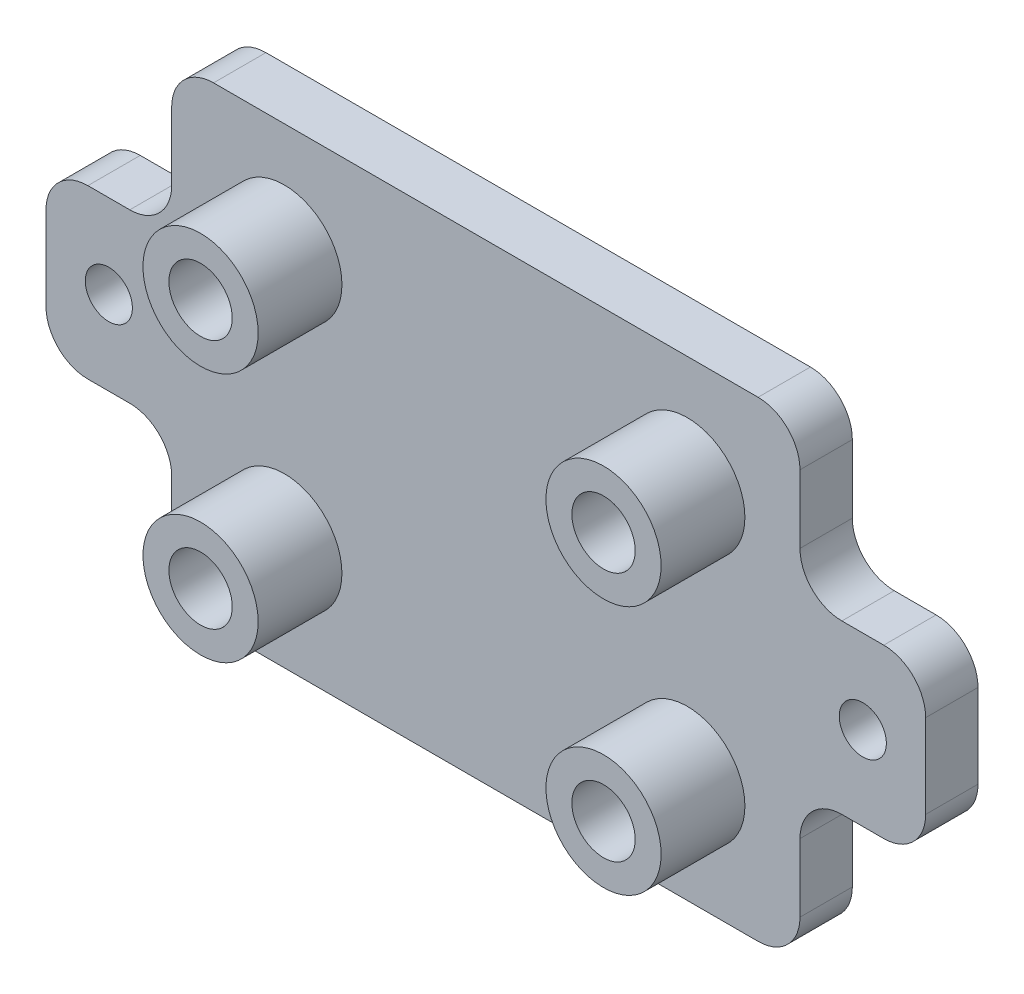
from build123d import *

# Parameters (mm, degrees)
SKETCH1_W            = 60
SKETCH1_H            = 45
BOSS_EXTRUDE1_DEPTH  = 5
SKETCH3_R            = 5.5
SKETCH3_R_2          = 3.025
BOSS_EXTRUDE2_DEPTH  = 8
SKETCH4_W            = 12
SKETCH4_H            = 16
SKETCH4_R            = 2.55
BOSS_EXTRUDE3_DEPTH  = 5
FILLET1_R            = 4
M4_CLEARANCE_HOLE1_D = 4.5
MIRROR1_OUTLINE_R    = 2.25
MIRROR1_DEPTH        = 5
FILLET2_R            = 4


# Read off the part's stored shape, not the designer's step: Mirror1
with BuildPart() as part:
    # Sketch1 → Boss-Extrude1 (new body)
    with BuildSketch(Plane.XY):
        Rectangle(SKETCH1_W, SKETCH1_H)
    extrude(amount=BOSS_EXTRUDE1_DEPTH)

    # Sketch3 → Boss-Extrude2 (add)
    # profile 1 of 4: a face of its own
    with BuildSketch(Plane.XY.offset(5)):
        with Locations((-19.2405, 11.938)):
            Circle(SKETCH3_R)
        with Locations((-19.2405, 11.938)):
            Circle(SKETCH3_R_2, mode=Mode.SUBTRACT)
    # profile 2 of 4: a face of its own
    with BuildSketch(Plane.XY.offset(5)):
        with Locations((-19.2405, -11.938)):
            Circle(SKETCH3_R)
        with Locations((-19.2405, -11.938)):
            Circle(SKETCH3_R_2, mode=Mode.SUBTRACT)
    # profile 3 of 4: a face of its own
    with BuildSketch(Plane.XY.offset(5)):
        with Locations((19.2405, 11.938)):
            Circle(SKETCH3_R)
        with Locations((19.2405, 11.938)):
            Circle(SKETCH3_R_2, mode=Mode.SUBTRACT)
    # profile 4 of 4: a face of its own
    with BuildSketch(Plane.XY.offset(5)):
        with Locations((19.2405, -11.938)):
            Circle(SKETCH3_R)
        with Locations((19.2405, -11.938)):
            Circle(SKETCH3_R_2, mode=Mode.SUBTRACT)
    extrude(amount=BOSS_EXTRUDE2_DEPTH)

    # Sketch4 → Boss-Extrude3 (add)
    # profile 1 of 2: a face of its own
    with BuildSketch(Plane.XY.offset(5)):
        with Locations((-36, 0)):
            Rectangle(SKETCH4_W, SKETCH4_H)
        with Locations((-36, 0)):
            Circle(SKETCH4_R, mode=Mode.SUBTRACT)
    # profile 2 of 2: a face of its own
    with BuildSketch(Plane.XY.offset(5)):
        with Locations((-36, 0)):
            Circle(SKETCH4_R)
    extrude(amount=-BOSS_EXTRUDE3_DEPTH)

    # Fillet1
    fillet1_edges = [part.edges().sort_by_distance(p)[0] for p in [
        (-42, -8, 2.5),
        (-42, 8, 2.5),
        (-30, 8, 2.5),
        (-30, -8, 2.5),
        (-30, 22.5, 2.5),
        (-30, -22.5, 2.5),
    ]]
    fillet(fillet1_edges, radius=FILLET1_R)

    # M4 Clearance Hole1 (through all)
    with Locations(Plane.XY.offset(5)):
        with Locations((-36, 0)):
            Hole(M4_CLEARANCE_HOLE1_D / 2)

    # Mirror1 outline → Mirror1 (add)
    with BuildSketch(Plane.XY):
        with BuildLine():
            ThreePointArc((42, 4), (40.828427125, 6.828427125), (38, 8))
            Line((38, 8), (30, 8))
            Line((30, 8), (30, -8))
            Line((30, -8), (38, -8))
            ThreePointArc((38, -8), (40.828427125, -6.828427125), (42, -4))
            Line((42, -4), (42, 4))
        make_face()
        with Locations((36, 0)):
            Circle(MIRROR1_OUTLINE_R, mode=Mode.SUBTRACT)
    extrude(amount=MIRROR1_DEPTH)

    # Fillet2
    fillet2_edges = [part.edges().sort_by_distance(p)[0] for p in [
        (30, -8, 2.5),
        (30, 8, 2.5),
        (30, 22.5, 2.5),
        (30, -22.5, 2.5),
    ]]
    fillet(fillet2_edges, radius=FILLET2_R)


solid = part.part
